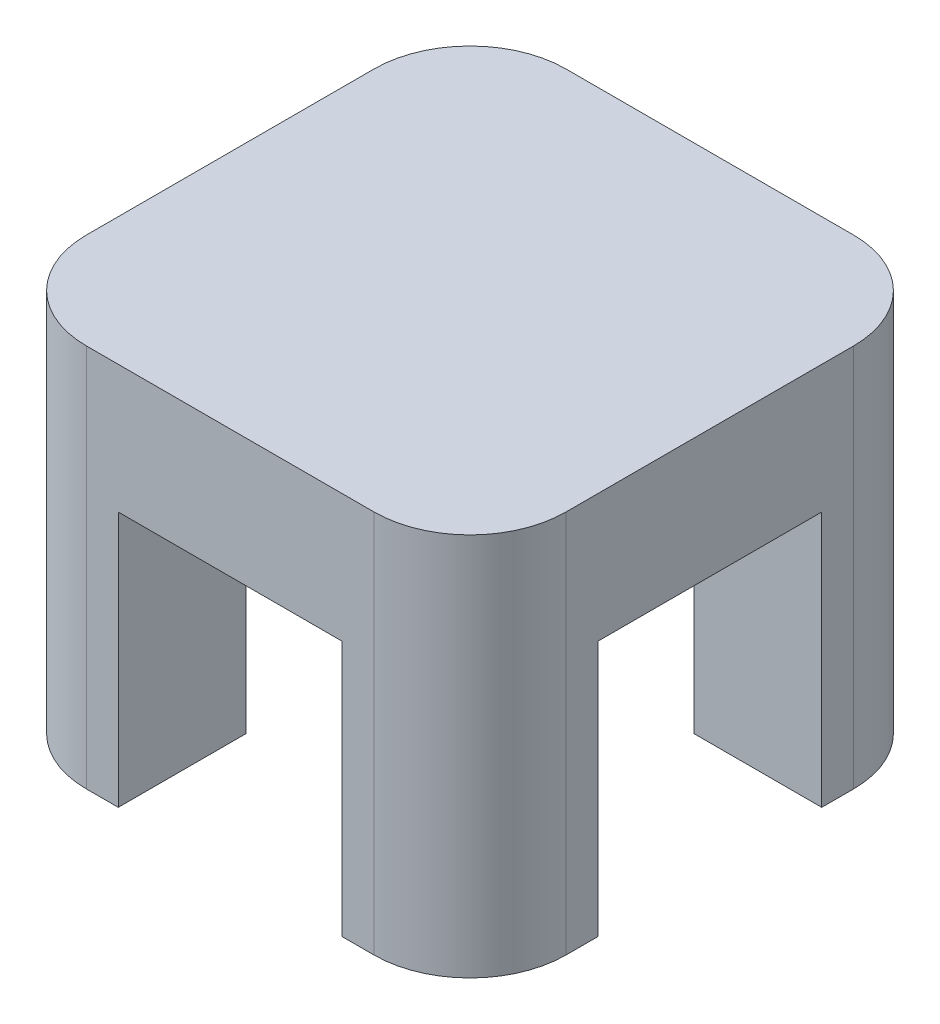
from build123d import *

# Parameters (mm, degrees)
CROQUIS1_W              = 150
CROQUIS1_H              = 150
SALIENTE_EXTRUIR1_DEPTH = 40
CROQUIS2_W              = 40
CROQUIS2_H              = 40
SALIENTE_EXTRUIR2_DEPTH = 80
REDONDEO1_R             = 30


with BuildPart() as part:
    # Croquis1 → Saliente-Extruir1 (new body)
    with BuildSketch(Plane(origin=(0, 0, 0), x_dir=(1, 0, 0), z_dir=(0, 1, 0))):
        Rectangle(CROQUIS1_W, CROQUIS1_H)
    extrude(amount=SALIENTE_EXTRUIR1_DEPTH)

    # Croquis2 → Saliente-Extruir2 (add)
    with BuildSketch(Plane(origin=(0, 0, 0), x_dir=(-1, 0, 0), z_dir=(0, -1, 0))):
        with Locations((55, -55)):
            Rectangle(CROQUIS2_W, CROQUIS2_H)
        with Locations((-55, -55)):
            Rectangle(CROQUIS2_W, CROQUIS2_H)
        with Locations((55, 55)):
            Rectangle(CROQUIS2_W, CROQUIS2_H)
        with Locations((-55, 55)):
            Rectangle(CROQUIS2_W, CROQUIS2_H)
    extrude(amount=SALIENTE_EXTRUIR2_DEPTH)

    # Redondeo1
    redondeo1_edges = [part.edges().sort_by_distance(p)[0] for p in [
        (-75, -20, -75),
        (75, -20, -75),
        (75, -20, 75),
        (-75, -20, 75),
    ]]
    fillet(redondeo1_edges, radius=REDONDEO1_R)


solid = part.part
